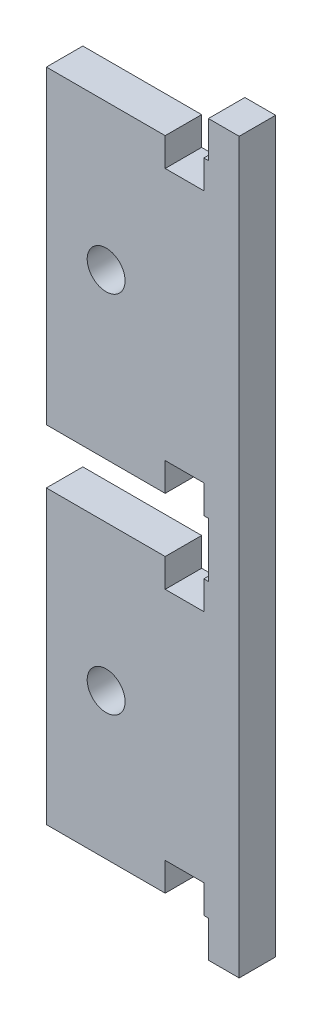
from build123d import *

# Parameters (mm, degrees)
SKETCH2_W               = 40.64
SKETCH2_H               = 127
BOSS_EXTRUDE1_DEPTH     = 6.35
M6_CLEARANCE_HOLE1_D    = 6.6
CUT_EXTRUDE1_DEPTH      = 134.495063954
CUT_EXTRUDE1_DEPTH_BACK = 134.495063954
SKETCH5_W               = 7.0505
SKETCH5_H               = 127
SKETCH6_W               = 28.23137
SKETCH6_H               = 6.35
SKETCH6_H_2             = 9.525
CUT_EXTRUDE2_DEPTH      = 134.495063954
SKETCH7_W               = 6.731
SKETCH7_H               = 5.1435
CUT_EXTRUDE3_DEPTH      = 134.495063954


with BuildPart() as part:
    # Sketch2 → Boss-Extrude1 (new body)
    with BuildSketch(Plane.XY):
        with Locations((20.32, 63.5)):
            Rectangle(SKETCH2_W, SKETCH2_H)
    extrude(amount=BOSS_EXTRUDE1_DEPTH)

    # M6 Clearance Hole1 (through all)
    with Locations(Plane.XY.offset(6.35)):
        with Locations((17.4625, 31.75), (17.4625, 95.25)):
            Hole(M6_CLEARANCE_HOLE1_D / 2)

    # Sketch5 → Cut-Extrude1 (cut, two sides: drawn at the far end of the back side and taken through both)
    with BuildSketch(Plane.XY.offset(6.35).offset(-CUT_EXTRUDE1_DEPTH_BACK)):
        with Locations((3.52525, 63.5)):
            Rectangle(SKETCH5_W, SKETCH5_H)
    extrude(amount=CUT_EXTRUDE1_DEPTH + CUT_EXTRUDE1_DEPTH_BACK, mode=Mode.SUBTRACT)

    # Sketch6 → Cut-Extrude2 (cut, through all)
    with BuildSketch(Plane.XY.offset(6.35)):
        with Locations((21.166185, 123.825)):
            Rectangle(SKETCH6_W, SKETCH6_H)
        with Locations((21.166185, 61.9125)):
            Rectangle(SKETCH6_W, SKETCH6_H_2)
        with Locations((21.166185, 3.175)):
            Rectangle(SKETCH6_W, SKETCH6_H)
    extrude(amount=-CUT_EXTRUDE2_DEPTH, mode=Mode.SUBTRACT)

    # Sketch7 → Cut-Extrude3 (cut, through all)
    with BuildSketch(Plane.XY.offset(6.35)):
        with Locations((31.115, 118.26875)):
            Rectangle(SKETCH7_W, SKETCH7_H)
        with Locations((31.115, 69.05625)):
            Rectangle(SKETCH7_W, SKETCH7_H)
        with Locations((31.115, 54.76875)):
            Rectangle(SKETCH7_W, SKETCH7_H)
        with Locations((31.115, 8.73125)):
            Rectangle(SKETCH7_W, SKETCH7_H)
    extrude(amount=-CUT_EXTRUDE3_DEPTH, mode=Mode.SUBTRACT)


solid = part.part
